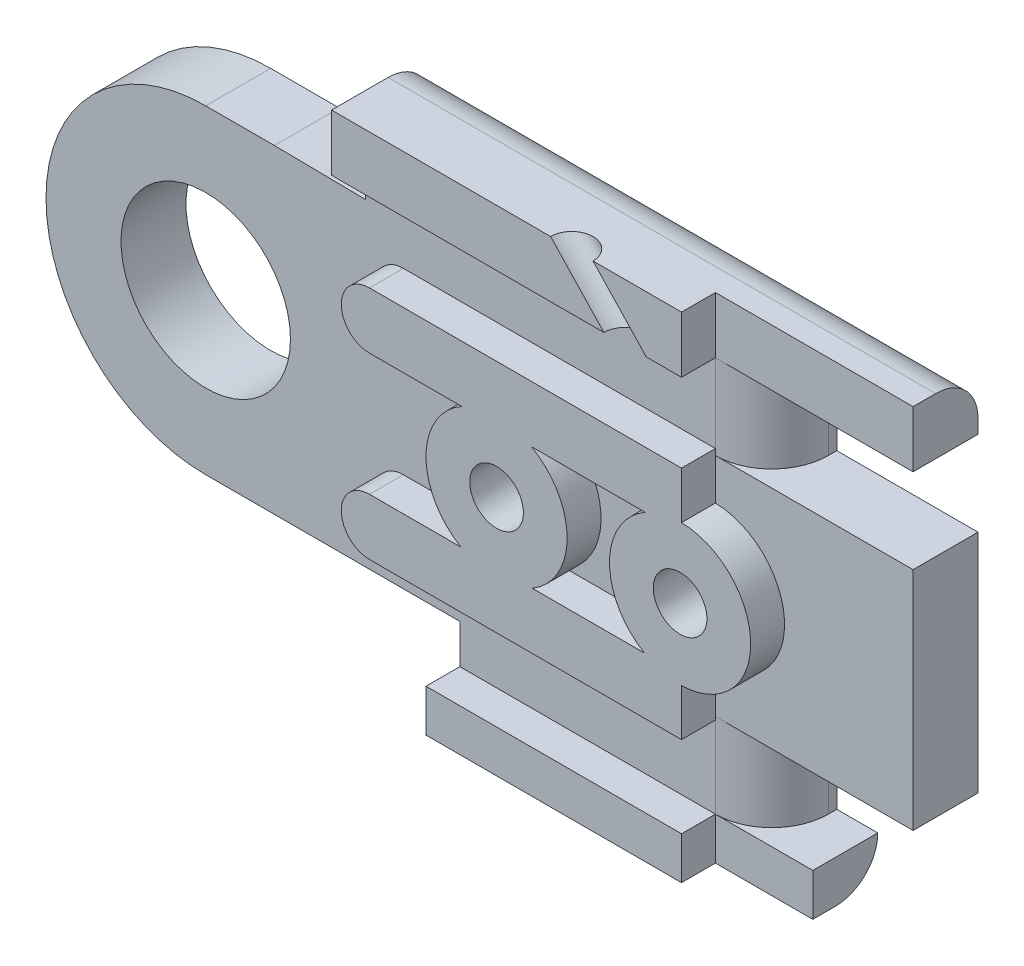
from build123d import *

# Parameters (mm, degrees)
BOSS_EXTRUDE1_DEPTH      = 2
BOSS_EXTRUDE6_DEPTH      = 4.5
CUT_EXTRUDE6_DEPTH       = 4.5
BOSS_EXTRUDE14_DEPTH     = 2.3
SKETCH32_R               = 3
CUT_EXTRUDE7_DEPTH       = 2.3
SKETCH33_W               = 12.393398282201806
SKETCH33_H               = 2.000000000000001
BOSS_EXTRUDE15_DEPTH     = 1.2
CUT_EXTRUDE8_DEPTH       = 2.4
SKETCH43_R               = 2.5000000000000004
SKETCH43_R_2             = 2.4999999999999982
BOSS_EXTRUDE17_DEPTH     = 1.2
CUT_EXTRUDE11_DEPTH      = 29.420773915365164
CUT_EXTRUDE11_DEPTH_BACK = 29.420773915365164
SKETCH44_R               = 0.9499999999999992
SKETCH44_R_2             = 0.9500000000000008
SKETCH49_R               = 0.7500000000000021
CUT_EXTRUDE13_DEPTH      = 3
FILLET1_R                = 1.5
FILLET3_START            = -1
FILLET3_DEPTH            = 8
FILLET3_START_2          = 5
FILLET3_2_DEPTH          = 21
FILLET3_3_DEPTH          = 8
SKETCH45_R               = 1.9999999999999996
SKETCH45_R_2             = 2.000000000000003
CUT_EXTRUDE15_DEPTH      = 4
FILLET4_R                = 2
BOSS_EXTRUDE18_DEPTH     = 12
SKETCH52_R               = 1.500000000000004
SKETCH52_R_2             = 1.5000000000000007
CUT_EXTRUDE16_DEPTH      = 12


with BuildPart() as part:
    # Sketch3 → Boss-Extrude1 (new body)
    with BuildSketch(Plane.XY):
        with BuildLine():
            Line((8.000000000000002, 0), (8.999999999999995, -2.5431457505076205))
            Line((8.999999999999995, -2.5431457505076205), (8.999999999999995, -7.043145750507605))
            Line((8.999999999999995, -7.043145750507605), (21.50000000000004, -7.043145750507604))
            Line((21.50000000000004, -7.043145750507604), (25.05025253169418, -7.043145750507604))
            Line((25.05025253169418, -7.043145750507604), (25.050252531694177, 7.456854249492383))
            Line((25.050252531694177, 7.456854249492383), (5.656854249492373, 7.456854249492379))
            Line((5.656854249492373, 7.456854249492379), (5.656854249492376, 5.656854249492382))
            ThreePointArc((5.656854249492376, 5.656854249492382), (7.391036260090296, 3.061467458920721), (8.000000000000002, 0))
        make_face()
    extrude(amount=BOSS_EXTRUDE1_DEPTH)

    # Sketch22 → Boss-Extrude6 (add)
    with BuildSketch(Plane.XY.offset(2)):
        with BuildLine():
            Line((5.656854249492378, 7.456854249492383), (21.500000000000025, 7.456854249492383))
            Line((21.500000000000025, 7.456854249492383), (25.050252531694177, 7.456854249492383))
            Line((25.050252531694177, 7.456854249492383), (25.05025253169418, -7.043145750507604))
            Line((25.05025253169418, -7.043145750507604), (8.999999999999995, -7.043145750507605))
            Line((8.999999999999995, -7.043145750507605), (8.999999999999995, -2.5431457505076205))
            Line((8.999999999999995, -2.5431457505076205), (7.999999999999998, 0))
            ThreePointArc((7.999999999999998, 0), (7.391036260090291, 3.061467458920719), (5.656854249492376, 5.656854249492382))
            Line((5.656854249492376, 5.656854249492382), (5.656854249492378, 7.456854249492383))
        make_face()
    extrude(amount=BOSS_EXTRUDE6_DEPTH)

    # Sketch26 → Cut-Extrude6 (cut)
    with BuildSketch(Plane.XY.offset(2)):
        Polygon((18.098080447707712, 5.299999999999999), (2.5300524575164793, 5.299999999999999), (2.5300524575164793, 4), (18.098080447707712, 4), (25.05025253169419, 4.000000000000001), (25.05025253169419, 5.299999999999999), align=None)
    extrude(amount=CUT_EXTRUDE6_DEPTH, mode=Mode.SUBTRACT)


with BuildPart() as body_2:
    # Sketch31 → Boss-Extrude14 (new body)
    with BuildSketch(Plane.XY.offset(6.5)):
        with BuildLine():
            Line((2.4326880657739025, 5.656854247099344), (0.00016454221484158, 5.656854247099344))
            ThreePointArc((0.00016454221484158, 5.656854247099344), (-5.656854248894122, 8.227110743131e-05), (0, -5.656854249492382))
            Line((0, -5.656854249492382), (9.000000000000004, -5.656854249492382))
            Line((9.000000000000004, -5.656854249492382), (8.999999999999995, -7.043145750507605))
            Line((8.999999999999995, -7.043145750507605), (8.999999999999995, -8.543145750507605))
            Line((8.999999999999995, -8.543145750507605), (21.50000000000004, -8.543145750507605))
            Line((21.50000000000004, -8.543145750507605), (21.50000000000004, -7.043145750507605))
            Line((21.50000000000004, -7.043145750507605), (25.05025253169418, -7.043145750507604))
            Line((25.05025253169418, -7.043145750507604), (25.05025253169418, 8.956854249492379))
            Line((25.05025253169418, 8.956854249492379), (5.656854249492376, 8.956854249492379))
            Line((5.656854249492376, 8.956854249492379), (5.656854249492378, 7.456854249492383))
            Line((5.656854249492378, 7.456854249492383), (5.656854249492376, 5.613708498984764))
            Line((5.656854249492376, 5.613708498984764), (2.4326880657739025, 5.656854247099344))
        make_face()
    extrude(amount=BOSS_EXTRUDE14_DEPTH)

    # Sketch32 → Cut-Extrude7 (cut)
    with BuildSketch(Plane.XY.offset(8.799999999999999)):
        Circle(SKETCH32_R)
    extrude(amount=-CUT_EXTRUDE7_DEPTH, mode=Mode.SUBTRACT)

    # Sketch33 → Boss-Extrude15 (add)
    with BuildSketch(Plane.XY.offset(8.799999999999999)):
        with Locations((11.853553390593277, 7.956854249492379)):
            Rectangle(SKETCH33_W, SKETCH33_H)
        Polygon((9.000000000000004, -7.043145750507606), (9.000000000000004, -8.543145750507605), (18.05025253169418, -8.543145750507605), (18.05025253169418, -7.0431457505076045), align=None)
        with BuildLine():
            Line((7.000000000000003, -4.156854249492383), (18.05025253169419, -4.156854249492383))
            Line((18.05025253169419, -4.156854249492383), (18.05025253169419, -2.1568542494923824))
            Line((18.05025253169419, -2.1568542494923824), (7.000000000000003, -2.1568542494923832))
            ThreePointArc((7.000000000000003, -2.1568542494923832), (6.000000000000003, -3.1568542494923832), (7.000000000000003, -4.156854249492383))
        make_face()
        with BuildLine():
            Line((18.05025253169419, 2.172006245196199), (7.000000000000003, 2.172006245196201))
            ThreePointArc((7.000000000000003, 2.172006245196201), (6.0000000000000036, 3.1720062451962), (7.000000000000003, 4.172006245196199))
            Line((7.000000000000003, 4.172006245196199), (18.05025253169419, 4.172006245196199))
            Line((18.05025253169419, 4.172006245196199), (18.05025253169419, 2.172006245196199))
        make_face()
    extrude(amount=BOSS_EXTRUDE15_DEPTH)


with BuildPart() as cut_extrude8_tool:
    # Sketch35 → Cut-Extrude8 (new body)
    with BuildSketch(Plane.XY.offset(8.799999999999999)):
        Polygon((25.05025253169418, 3.956854249492379), (25.05025253169418, 6.9568542494923795), (20.05025253169418, 6.956854249492378), (20.05025253169418, 3.9568542494923773), align=None)
        Polygon((25.05025253169418, -7.043145750507604), (20.05025253169419, -7.0431457505076045), (20.05025253169419, -4.043145750507604), (25.05025253169418, -4.043145750507604), align=None)
    extrude(amount=-CUT_EXTRUDE8_DEPTH)


with BuildPart() as part_1:
    add(part.part)

    # Cut-Extrude8: cut by cut_extrude8_tool
    add(cut_extrude8_tool.part, mode=Mode.SUBTRACT)


with BuildPart() as body_2_1:
    add(body_2.part)

    # Cut-Extrude8: cut by cut_extrude8_tool
    add(cut_extrude8_tool.part, mode=Mode.SUBTRACT)

    # Sketch43 → Boss-Extrude17 (add)
    with BuildSketch(Plane.XY.offset(8.799999999999999)):
        with Locations((11.500000000000004, 0)):
            Circle(SKETCH43_R)
        with Locations((18.000000000000004, 0)):
            Circle(SKETCH43_R_2)
    extrude(amount=BOSS_EXTRUDE17_DEPTH)


with BuildPart() as cut_extrude11_tool:
    # Sketch44 → Cut-Extrude11 (new, two sides: drawn at the far end of the back side and taken through both)
    with BuildSketch(Plane.XY.offset(9.999999999999998).offset(-CUT_EXTRUDE11_DEPTH_BACK)):
        with Locations((11.500000000000004, 0)):
            Circle(SKETCH44_R)
        with Locations((18.000000000000004, 0)):
            Circle(SKETCH44_R_2)
    extrude(amount=CUT_EXTRUDE11_DEPTH + CUT_EXTRUDE11_DEPTH_BACK)


with BuildPart() as part_2:
    add(part_1.part)

    # Cut-Extrude11: cut by cut_extrude11_tool
    add(cut_extrude11_tool.part, mode=Mode.SUBTRACT)

    # Fillet3: read off the stored shape, not the designer's step
    # Fillet3 outline → Fillet3 (cut)
    with BuildSketch(Plane.XY.offset(FILLET3_START)):
        with BuildLine():
            Line((9, -7.043145751), (10, -7.043145751))
            add(Edge.make_bspline(
                [(10, -7.043145751), (8.99999999999999, -7.043145750507609), (9, -6.043145751)],
                knots=[0, 0, 0, 1, 1, 1], degree=2, weights=[1, 0.7071067811865481, 1]))
            Line((9, -6.043145751), (9, -7.043145751))
        make_face()
        with BuildLine():
            Line((5.656854249, 7.456854249), (5.656854249, 6.456854249))
            add(Edge.make_bspline(
                [(5.656854249, 6.456854249), (5.656854249492369, 7.4568542494923795), (6.656854249, 7.456854249)],
                knots=[0, 0, 0, 1, 1, 1], degree=2, weights=[1, 0.707106781186547, 1]))
            Line((6.656854249, 7.456854249), (5.656854249, 7.456854249))
        make_face()
    extrude(amount=FILLET3_DEPTH, mode=Mode.SUBTRACT)

    # Fillet3 2 outline → Fillet3 2 (cut)
    with BuildSketch(Plane.YZ.offset(FILLET3_START_2)):
        with BuildLine():
            Line((-7.043145751, 0), (-6.043145751, 0))
            add(Edge.make_bspline(
                [(-6.043145751, 0), (-7.0431457505076045, 0), (-7.043145751, 1)],
                knots=[0, 0, 0, 1, 1, 1], degree=2, weights=[1, 0.707106781186548, 1]))
            Line((-7.043145751, 1), (-7.043145751, 0))
        make_face()
        with BuildLine():
            add(Edge.make_bspline(
                [(6.456854249, 0), (7.456854249492381, 0), (7.456854249, 1)],
                knots=[0, 0, 0, 1, 1, 1], degree=2, weights=[1, 0.707106781186548, 1]))
            Line((6.456854249, 0), (7.456854249, 0))
            Line((7.456854249, 0), (7.456854249, 1))
        make_face()
    extrude(amount=FILLET3_2_DEPTH, mode=Mode.SUBTRACT)

    # Fillet3 3 outline → Fillet3 3 (cut)
    with BuildSketch(Plane.XY.offset(FILLET3_START)):
        with BuildLine():
            Line((25.050252532, -7.043145751), (25.050252532, -6.043145751))
            add(Edge.make_bspline(
                [(25.050252532, -6.043145751), (25.050252531694195, -7.0431457505076045), (24.050252532, -7.043145751)],
                knots=[0, 0, 0, 1, 1, 1], degree=2, weights=[1, 0.707106781186548, 1]))
            Line((24.050252532, -7.043145751), (25.050252532, -7.043145751))
        make_face()
        with BuildLine():
            Line((25.050252532, 6.456854249), (25.050252532, 7.456854249))
            Line((25.050252532, 7.456854249), (24.050252532, 7.456854249))
            add(Edge.make_bspline(
                [(24.050252532, 7.456854249), (24.23662286224227, 7.456854249492371), (24.442904569552457, 7.413222711328381), (24.646119560607424, 7.308816022097408), (24.808964717093836, 7.142726196138974), (24.971827345010716, 6.860639849810825), (25.01301948040526, 6.758429238057051), (25.038618001980854, 6.6546327736033515), (25.050252531694174, 6.553326631418876), (25.050252532, 6.456854249)],
                knots=[0, 0, 0, 0, 0, 0, 0.6589186227127712, 0.6589186227127712, 0.6589186227127712, 0.6589186227127712, 1.0000000000000395, 1.0000000000000395, 1.0000000000000395, 1.0000000000000395, 1.0000000000000395, 1.0000000000000395], degree=5, weights=[1, 1.0000000000000024, 0.9950915544751191, 0.9930584097693568, 0.9999999999999981, 1.0000000000000009, 0.9997935626898684, 0.9999244387002607, 0.9999999999999992, 1]))
        make_face()
    extrude(amount=FILLET3_3_DEPTH, mode=Mode.SUBTRACT)

    # Sketch45 → Cut-Extrude15 (cut)
    with BuildSketch(Plane(origin=(0, 0, 0), x_dir=(-1, 0, 0), z_dir=(0, 0, -1))):
        with Locations((-11.500000000000004, 0)):
            Circle(SKETCH45_R)
        with Locations((-18.000000000000004, 0)):
            Circle(SKETCH45_R_2)
    extrude(amount=-CUT_EXTRUDE15_DEPTH, mode=Mode.SUBTRACT)

    # Sketch51 → Boss-Extrude18 (add)
    with BuildSketch(Plane(origin=(25.05025253169418, 5.99e-15, 0), x_dir=(0, 0, -1), z_dir=(1, 2.4e-16, 0))):
        Polygon((-9.5e-16, 3.9999999999999947), (3e-17, -4.000000000000005), (-3, -4.000000000000005), (-3.000000000000001, 3.9999999999999942), align=None)
    extrude(amount=BOSS_EXTRUDE18_DEPTH)

    # Sketch52 → Cut-Extrude16 (cut)
    with BuildSketch(Plane(origin=(0, 0, 0), x_dir=(-1, 0, 0), z_dir=(0, 0, -1))):
        with Locations((-34.05025253169418, 3.47e-15)):
            Circle(SKETCH52_R)
        with Locations((-28.05025253169418, 3.9e-15)):
            Circle(SKETCH52_R_2)
    extrude(amount=-CUT_EXTRUDE16_DEPTH, mode=Mode.SUBTRACT)


with BuildPart() as body_2_2:
    add(body_2_1.part)

    # Cut-Extrude11: cut by cut_extrude11_tool
    add(cut_extrude11_tool.part, mode=Mode.SUBTRACT)

    # Sketch49 → Cut-Extrude13 (cut, along a direction that is not the sketch's normal)
    with BuildSketch(Plane.XZ.offset(-6.956854249492379)):
        with Locations((16.05025253169419, 9.999999999999998)):
            Circle(SKETCH49_R)
    extrude(amount=-CUT_EXTRUDE13_DEPTH, dir=(0.6858421465414155, -0.7277503349552398, 0), mode=Mode.SUBTRACT)

    # Fillet1
    fillet1_edges = [body_2_2.edges().sort_by_distance(p)[0] for p in [
        (15.353553390593278, 8.956854249492379, 6.5),
        (15.250000000000018, -8.543145750507605, 6.5),
    ]]
    fillet(fillet1_edges, radius=FILLET1_R)

    # Fillet4
    fillet4_edges = [body_2_2.edges().sort_by_distance(p)[0] for p in [
        (20.05025253169418, 5.456854249492378, 8.799999999999999),
        (20.05025253169419, -5.543145750507604, 8.799999999999999),
    ]]
    fillet(fillet4_edges, radius=FILLET4_R - 0.0001)  # a hair under: the kernel refuses the full size


solid = body_2_2.part
